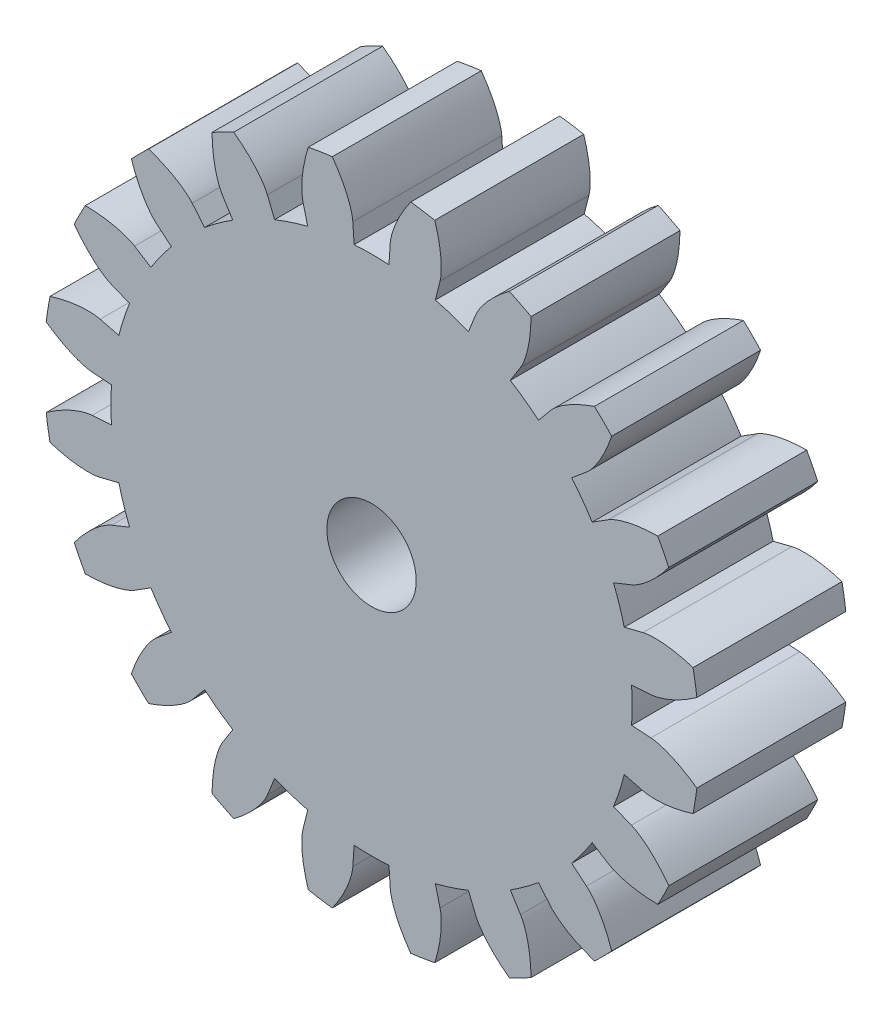
from build123d import *

# Parameters (mm, degrees)
SKETCH_1_R               = 11
SKETCH_1_R_2             = 1.5
EXTRUDE_1_DEPTH          = 5
CUT_EXTRUDE_1_DEPTH      = 17.340134638
PATTERN_CIRCULAR_1_COUNT = 20
PATTERN_CIRCULAR_1_ANGLE = 342


with BuildPart() as part:
    # 草图1 → 凸台-拉伸1 (new body)
    with BuildSketch(Plane.XY):
        Circle(SKETCH_1_R)
        Circle(SKETCH_1_R_2, mode=Mode.SUBTRACT)
    extrude(amount=EXTRUDE_1_DEPTH)

    # 草图1<3> → 切除-拉伸1 (cut, through all)
    with BuildSketch(Plane.XY):
        with BuildLine():
            Line((9.375922045, 0.627939455), (8.730441857, 0.584709309))
            ThreePointArc((8.730441857, 0.584709309), (8.745109097, 0.29251816), (8.75, 0))
            ThreePointArc((8.75, 0), (8.745109097, -0.29251816), (8.730441857, -0.584709309))
            Line((8.730441857, -0.584709309), (9.375922045, -0.627939455))
            add(Edge.make_bspline(
                [(9.375922045, -0.627939455), (9.411619311, -0.63033023), (9.482596211, -0.638448444), (9.679350326, -0.678657899), (10.042849676, -0.799560533), (10.395556322, -0.972784043), (10.698341725, -1.160245691), (10.884276611, -1.28995038), (10.920979031, -1.316137153)],
                knots=[0, 0, 0, 0, 0, 0.002802034, 0.005604068, 0.015718248, 0.029959916, 0.03349563, 0.03349563, 0.03349563, 0.03349563, 0.03349563], degree=4))
            ThreePointArc((10.920979031, -1.316137153), (10.980226986, -0.659253615), (11, 0))
            ThreePointArc((11, 0), (10.980226986, 0.659253615), (10.920979031, 1.316137153))
            add(Edge.make_bspline(
                [(9.375922045, 0.627939455), (9.411619311, 0.63033023), (9.482596211, 0.638448444), (9.679350326, 0.678657899), (10.042849676, 0.799560533), (10.395556322, 0.972784043), (10.698341725, 1.160245691), (10.884276611, 1.28995038), (10.920979031, 1.316137153)],
                knots=[0, 0, 0, 0, 0, 0.002802034, 0.005604068, 0.015718248, 0.029959916, 0.03349563, 0.03349563, 0.03349563, 0.03349563, 0.03349563], degree=4))
        make_face()
    cut_extrude_1 = extrude(amount=CUT_EXTRUDE_1_DEPTH, mode=Mode.SUBTRACT)

    # 阵列(圆周)1: 切除-拉伸1 ×20 about axis
    pattern_circular_1_axis = Axis((0, 0, 5), (0, 0, 1))
    for i in range(1, PATTERN_CIRCULAR_1_COUNT):
        add(cut_extrude_1.rotate(pattern_circular_1_axis, i * PATTERN_CIRCULAR_1_ANGLE / (PATTERN_CIRCULAR_1_COUNT - 1)), mode=Mode.SUBTRACT)


solid = part.part
